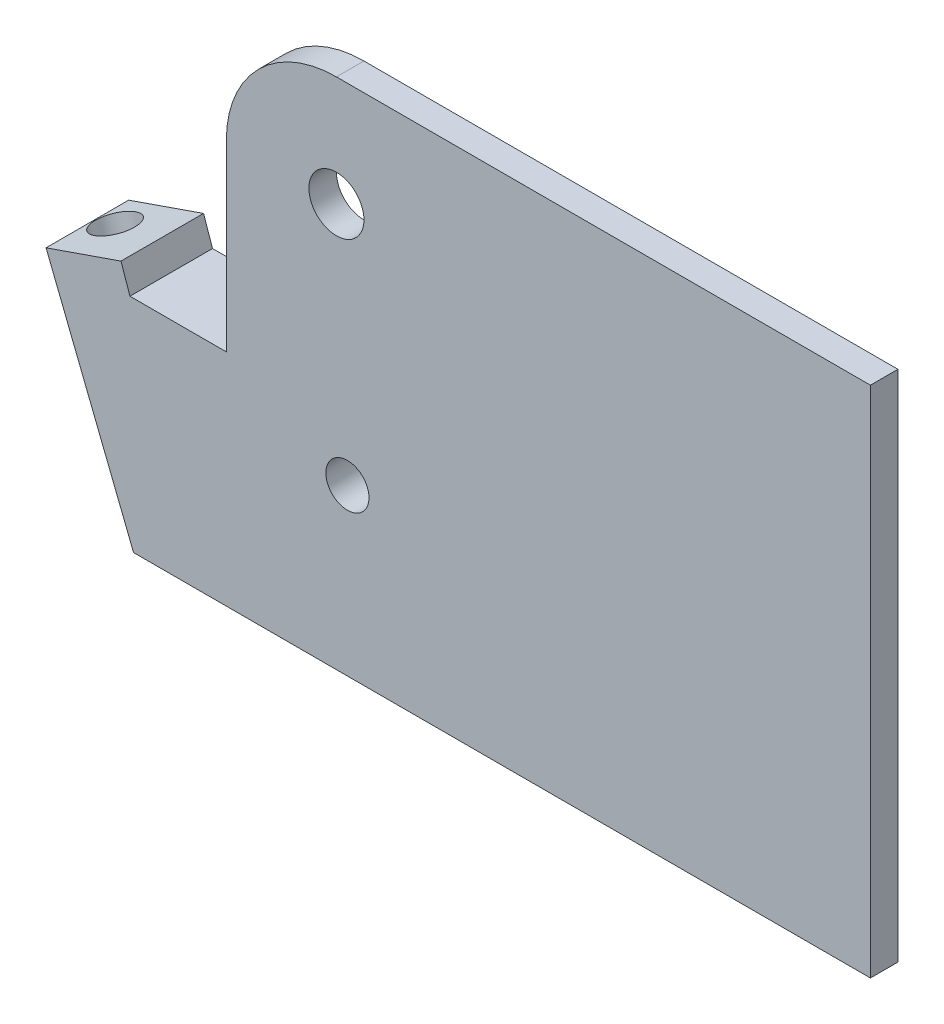
from build123d import *

# Parameters (mm, degrees)
SKETCH2_R                          = 3.175
BOSS_EXTRUDE1_DEPTH                = 3.175
BOSS_EXTRUDE2_DEPTH                = 6.35
F_3_16_0_1875_DIAMETER_HOLE1_D     = 4.7625
F_3_16_0_1875_DIAMETER_HOLE1_DEPTH = 2.54
F_3_16_0_1875_DIAMETER_HOLE1_TIP   = 1.430799349
F_10_CLEARANCE_HOLE1_D             = 4.9784


with BuildPart() as part:
    # Sketch2 → Boss-Extrude1 (new body)
    with BuildSketch(Plane.XY):
        with BuildLine():
            Line((-60.011006221, -224.252380141), (-48.895, -224.252380141))
            Line((-48.895, -224.252380141), (-48.895, -203.133359856))
            ThreePointArc((-48.895, -203.133359856), (-45.175256121, -194.153103735), (-36.195, -190.433359856))
            Line((-36.195, -190.433359856), (25.4, -190.433359856))
            Line((25.4, -190.433359856), (25.4, -224.252380141))
            Line((25.4, -224.252380141), (25.4, -249.652380141))
            Line((25.4, -249.652380141), (-59.596404771, -249.652380141))
            Line((-59.596404771, -249.652380141), (-69.686856366, -224.252380141))
            Line((-69.686856366, -224.252380141), (-61.0470258, -221.260552334))
            Line((-61.0470258, -221.260552334), (-60.011006221, -224.252380141))
        make_face()
        with Locations((-36.195, -203.133359856)):
            Circle(SKETCH2_R, mode=Mode.SUBTRACT)
    extrude(amount=BOSS_EXTRUDE1_DEPTH)

    # Sketch3 → Boss-Extrude2 (add)
    with BuildSketch(Plane(origin=(0, 0, 0), x_dir=(-1, 0, 0), z_dir=(0, 0, -1))):
        Polygon((69.686856366, -224.252380141), (59.596404771, -249.652380141), (25.4, -249.652380141), (25.4, -224.252380141), (60.011006221, -224.252380141), (61.0470258, -221.260552334), align=None)
    extrude(amount=BOSS_EXTRUDE2_DEPTH)

    # 3/16 (0.1875) Diameter Hole1
    with Locations(Plane(origin=(61.878548145, -178.693496479, 0), x_dir=(0.9449482956701711, 0.3272196792829536, 0), z_dir=(-0.3272196792829536, 0.9449482956701711, 0))):
        with Locations((-136.690268062, 2.38125)):
            Hole(F_3_16_0_1875_DIAMETER_HOLE1_D / 2, depth=F_3_16_0_1875_DIAMETER_HOLE1_DEPTH)
            with Locations((0, 0, -(F_3_16_0_1875_DIAMETER_HOLE1_DEPTH + F_3_16_0_1875_DIAMETER_HOLE1_TIP / 2))):  # 118° drill point
                Cone(0, F_3_16_0_1875_DIAMETER_HOLE1_D / 2, F_3_16_0_1875_DIAMETER_HOLE1_TIP, mode=Mode.SUBTRACT)

    # #10 Clearance Hole1 (through all)
    with Locations(Plane(origin=(0, 0, -6.35), x_dir=(-1, 0, 0), z_dir=(0, 0, -1))):
        with Locations((34.925, -230.602380141)):
            Hole(F_10_CLEARANCE_HOLE1_D / 2)


solid = part.part
